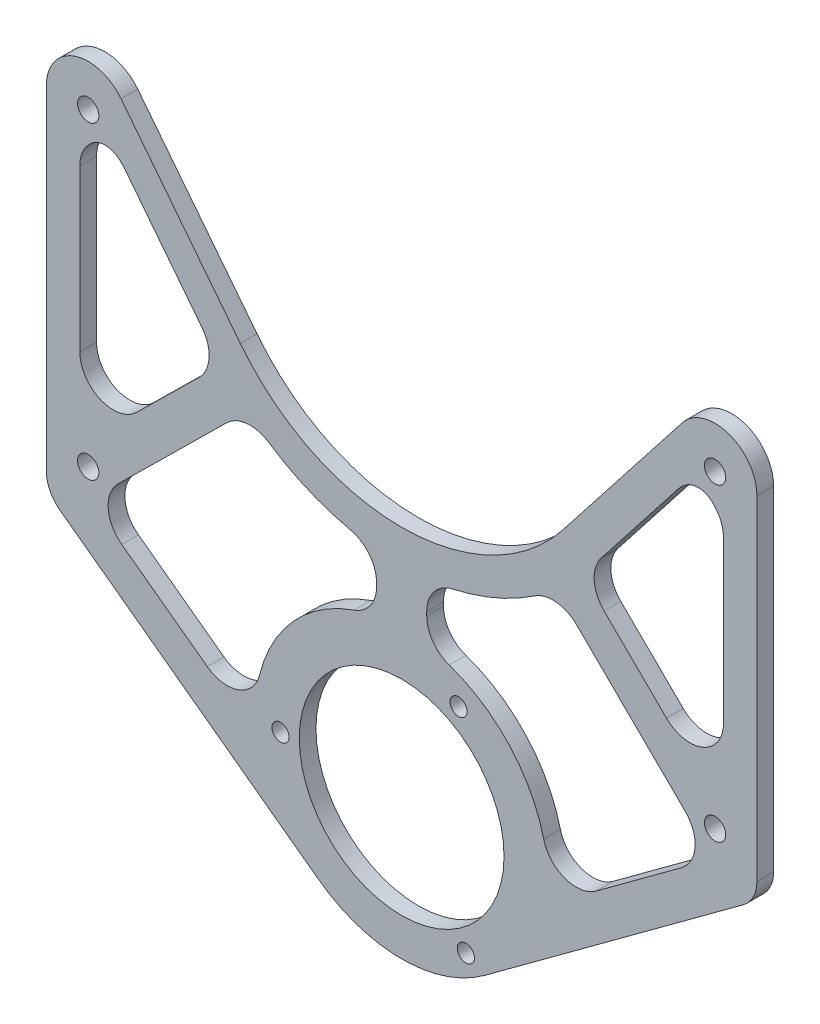
from build123d import *

# Parameters (mm, degrees)
SKETCH_1_R          = 2.55
EXTRUDE_1_DEPTH     = 4
EXTRUDE_2_DEPTH     = 4
FILLET_2_R          = 10
SKETCH_5_R          = 2.05
SKETCH_5_R_2        = 24.5
CUT_EXTRUDE_1_DEPTH = 5
CUT_EXTRUDE_2_DEPTH = 5
CUT_EXTRUDE_3_DEPTH = 25
FILLET_3_R          = 8
FILLET_4_R          = 5


with BuildPart() as part:
    # 草图1 → 凸台-拉伸1 (new body)
    with BuildSketch(Plane.XY):
        with BuildLine():
            Line((-85, -84), (85, -84))
            Line((85, -84), (85, 10))
            Line((85, 10), (48.019813619, 10))
            ThreePointArc((48.019813619, 10), (0, -49.05), (-48.019813619, 10))
            Line((-48.019813619, 10), (-85, 10))
            Line((-85, 10), (-85, -84))
        make_face()
        with Locations((75, 0)):
            Circle(SKETCH_1_R, mode=Mode.SUBTRACT)
        with Locations((-75, 0)):
            Circle(SKETCH_1_R, mode=Mode.SUBTRACT)
        with Locations((-75, -74)):
            Circle(SKETCH_1_R, mode=Mode.SUBTRACT)
        with Locations((75, -74)):
            Circle(SKETCH_1_R, mode=Mode.SUBTRACT)
    extrude(amount=EXTRUDE_1_DEPTH)

    # 草图2 → 凸台-拉伸2 (add)
    with BuildSketch(Plane.XY.offset(4)):
        with BuildLine():
            Line((-85, -84), (-19.866917685, -131.97323825))
            ThreePointArc((-19.866917685, -131.97323825), (0, -138.5), (19.866917685, -131.97323825))
            Line((19.866917685, -131.97323825), (85, -84))
            Line((85, -84), (-85, -84))
        make_face()
    extrude(amount=-EXTRUDE_2_DEPTH)

    # 圆角2
    fillet_2_edges = [part.edges().sort_by_distance(p)[0] for p in [
        (85, 10, 2),
        (-85, 10, 2),
    ]]
    fillet(fillet_2_edges, radius=FILLET_2_R)

    # 草图5 → 切除-拉伸1 (cut)
    with BuildSketch(Plane.XY.offset(4)):
        with Locations((15.367658663, -129.593394789)):
            Circle(SKETCH_5_R)
        with Locations((-28.982333984, -106.012085404)):
            Circle(SKETCH_5_R)
        with Locations((13.614675321, -79.394519807)):
            Circle(SKETCH_5_R)
        with Locations((0, -105)):
            Circle(SKETCH_5_R_2)
    extrude(amount=-CUT_EXTRUDE_1_DEPTH, mode=Mode.SUBTRACT)

    # 草图6 → 切除-拉伸2 (cut)
    with BuildSketch(Plane.XY.offset(4)):
        with BuildLine():
            Line((-67.126666667, 6.165275519), (-38.6187, -30.24067642))
            Line((-38.6187, -30.24067642), (38.6187, -30.24067642))
            Line((38.6187, -30.24067642), (67.126666667, 6.165275519))
            ThreePointArc((67.126666667, 6.165275519), (70.621230492, 8.990349136), (75, 10))
            Line((75, 10), (-75, 10))
            ThreePointArc((-75, 10), (-70.621230492, 8.990349136), (-67.126666667, 6.165275519))
        make_face()
    extrude(amount=-CUT_EXTRUDE_2_DEPTH, mode=Mode.SUBTRACT)

    # 草图7 → 切除-拉伸3 (cut)
    with BuildSketch(Plane.XY.offset(4)):
        Polygon((-77, -5.144778907), (-68.857155974, -4.600712255), (-43.359613768, -37.162217147), (-77, -70.354064895), align=None)
        with BuildLine():
            ThreePointArc((-36.942273764, -43.473795661), (-22.471434931, -52.437935811), (-6, -56.733609968))
            Line((-6, -56.733609968), (-6, -70.518120701))
            ThreePointArc((-6, -70.518120701), (-28.302069217, -84.408912655), (-34.654792832, -109.903604165))
            Line((-34.654792832, -109.903604165), (-74.514618659, -80.545175958))
            Line((-74.514618659, -80.545175958), (-36.942273764, -43.473795661))
        make_face()
        with BuildLine():
            ThreePointArc((34.654792832, -109.903604165), (28.302069217, -84.408912655), (6, -70.518120701))
            Line((6, -70.518120701), (6, -56.733609968))
            ThreePointArc((6, -56.733609968), (22.471434931, -52.437935811), (36.942273764, -43.473795661))
            Line((36.942273764, -43.473795661), (74.514618659, -80.545175958))
            Line((74.514618659, -80.545175958), (34.654792832, -109.903604165))
        make_face()
        Polygon((77, -70.354064895), (43.359613768, -37.162217147), (68.857155974, -4.600712255), (77, -5.144778907), align=None)
    extrude(amount=-CUT_EXTRUDE_3_DEPTH, mode=Mode.SUBTRACT)

    # 圆角3
    # the kernel refuses this fillet: 8 mm, written as the material it adds along each edge
    with BuildSketch(Plane(origin=(-6, -56.733609968, 4), x_dir=(0, -1, 0), z_dir=(0, 0, -1))) as fillet_3_piece_1:
        with BuildLine():
            CenterArc((6.791995106, 8), FILLET_3_R, 192.428379519, 77.571620481)
            ThreePointArc((-1.020531268, 6.278247502), (-0.422700314, 3.153357523), (0, 0))
            Line((0, 0), (6.791995106, 0))
        make_face()
    extrude(amount=4)
    with BuildSketch(Plane(origin=(-6, -70.518120701, 4), x_dir=(-0.9684273836136271, -0.2492958135774943, 0), z_dir=(0, 0, -1))) as fillet_3_piece_2:
        with BuildLine():
            CenterArc((6.207961727, 7.97462195), FILLET_3_R, 194.435845985, 70.999197637)
            Line((-1.539457342, 5.980255442), (0, 0))
            ThreePointArc((0, 0), (2.785623852, 0.111028967), (5.571247704, 0))
        make_face()
    extrude(amount=4)
    with BuildSketch(Plane(origin=(-34.654792832, -109.903604165, 4), x_dir=(-0.8051712910421941, 0.5930423189633656, 0), z_dir=(0, 0, -1))) as fillet_3_piece_3:
        with BuildLine():
            CenterArc((14.713311973, 8), FILLET_3_R, 157.435643024, 112.564356976)
            ThreePointArc((7.325719141, 11.069767442), (4.192460552, 5.184405893), (0, 0))
            Line((0, 0), (14.713311973, 0))
        make_face()
    extrude(amount=4)
    with BuildSketch(Plane(origin=(-74.514618659, -80.545175958, 4), x_dir=(0.711836432832338, 0.7023452803945736, 0), z_dir=(0, 0, -1)), Plane(origin=(74.514618659, -80.545175958, 4), x_dir=(-0.8051712910421942, -0.5930423189633655, 0), z_dir=(0, 0, -1))) as fillet_3_piece_4:
        with BuildLine():
            CenterArc((FILLET_3_R * 1.17108402506, FILLET_3_R), FILLET_3_R, 170.988669267, 99.011330733)
            Line((FILLET_3_R * 0.183426640042, FILLET_3_R * 1.15662978584), (0, 0))
            Line((0, 0), (FILLET_3_R * 1.17108402506, 0))
        make_face()
    extrude(amount=4)
    with BuildSketch(Plane(origin=(-36.942273764, -43.473795661, 4), x_dir=(-0.711836432832338, -0.7023452803945739, 0), z_dir=(0, 0, -1))) as fillet_3_piece_5:
        with BuildLine():
            CenterArc((6.907291952, -8), FILLET_3_R, 90, 78.47203041)
            ThreePointArc((-0.931326161, -6.401229823), (-0.374864481, -3.213825359), (0, 0))
            Line((0, 0), (6.907291952, 0))
        make_face()
    extrude(amount=4)
    with BuildSketch(Plane(origin=(43.359613768, -37.162217147, 4), x_dir=(0.616527551876007, 0.7873333333333332, 0), z_dir=(0, 0, -1)), Plane(origin=(-43.359613768, -37.162217147, 4), x_dir=(-0.7118364328323388, -0.7023452803945729, 0), z_dir=(0, 0, -1))) as fillet_3_piece_6:
        with BuildLine():
            CenterArc((FILLET_3_R * 0.891711791031, FILLET_3_R), FILLET_3_R, 186.552471372, 83.447528628)
            Line((-FILLET_3_R * 0.101755976712, FILLET_3_R * 0.885886922506), (0, 0))
            Line((0, 0), (FILLET_3_R * 0.891711791031, 0))
        make_face()
    extrude(amount=4)
    with BuildSketch(Plane(origin=(68.857155974, -4.600712255, 4), x_dir=(0.9977753031397176, -0.06666666666666672, 0), z_dir=(0, 0, -1)), Plane(origin=(-68.857155974, -4.600712255, 4), x_dir=(0.6165275518760065, -0.7873333333333337, 0), z_dir=(0, 0, -1))) as fillet_3_piece_7:
        with BuildLine():
            CenterArc((FILLET_3_R * 0.529020931448, FILLET_3_R), FILLET_3_R, 214.240445239, 55.759554761)
            Line((-FILLET_3_R * 0.297662660682, FILLET_3_R * 0.437332923922), (0, 0))
            Line((0, 0), (FILLET_3_R * 0.529020931448, 0))
        make_face()
    extrude(amount=4)
    with BuildSketch(Plane(origin=(77, -5.144778907, 4), x_dir=(0, -1, 0), z_dir=(0, 0, -1))) as fillet_3_piece_8:
        with BuildLine():
            CenterArc((FILLET_3_R * 0.935414346693, FILLET_3_R), FILLET_3_R, 183.822553729, 86.177446271)
            Line((-FILLET_3_R * 0.0623609564462, FILLET_3_R * 0.933333333333), (0, 0))
            Line((0, 0), (FILLET_3_R * 0.935414346693, 0))
        make_face()
    extrude(amount=4)
    with BuildSketch(Plane(origin=(77, -70.354064895, 4), x_dir=(0, 1, 0), z_dir=(0, 0, -1))) as fillet_3_piece_9:
        with BuildLine():
            CenterArc((FILLET_3_R * 2.39148377615, -FILLET_3_R), FILLET_3_R, 90, 134.61547034)
            Line((FILLET_3_R * 1.67964734332, -FILLET_3_R * 1.70234528039), (0, 0))
            Line((0, 0), (FILLET_3_R * 2.39148377615, 0))
        make_face()
    extrude(amount=4)
    with BuildSketch(Plane(origin=(-77, -70.354064895, 4), x_dir=(0, 1, 0), z_dir=(0, 0, -1))) as fillet_3_piece_10:
        with BuildLine():
            CenterArc((FILLET_3_R * 2.39148377615, FILLET_3_R), FILLET_3_R, 135.38452966, 134.61547034)
            Line((FILLET_3_R * 1.67964734332, FILLET_3_R * 1.70234528039), (0, 0))
            Line((0, 0), (FILLET_3_R * 2.39148377615, 0))
        make_face()
    extrude(amount=4)
    with BuildSketch(Plane(origin=(-77, -5.144778907, 4), x_dir=(0, -1, 0), z_dir=(0, 0, -1))) as fillet_3_piece_11:
        with BuildLine():
            CenterArc((FILLET_3_R * 0.935414346693, -FILLET_3_R), FILLET_3_R, 90, 86.177446271)
            Line((-FILLET_3_R * 0.0623609564462, -FILLET_3_R * 0.933333333333), (0, 0))
            Line((0, 0), (FILLET_3_R * 0.935414346693, 0))
        make_face()
    extrude(amount=4)
    with BuildSketch(Plane(origin=(6, -56.733609968, 4), x_dir=(0.9870448668515611, 0.16044447893892722, 0), z_dir=(0, 0, -1))) as fillet_3_piece_12:
        with BuildLine():
            CenterArc((6.806620819, 7.987559736), FILLET_3_R, 189.232696301, 77.571620481)
            Line((-1.089738116, 6.704003905), (0, 0))
            ThreePointArc((0, 0), (3.180325289, 0.08871463), (6.360650577, 0))
        make_face()
    extrude(amount=4)
    with BuildSketch(Plane(origin=(36.942273764, -43.473795661, 4), x_dir=(0.7118364328323379, -0.7023452803945738, 0), z_dir=(0, 0, -1))) as fillet_3_piece_13:
        with BuildLine():
            CenterArc((6.907291952, 8), FILLET_3_R, 191.52796959, 78.47203041)
            ThreePointArc((-0.931326161, 6.401229823), (-0.374864481, 3.213825359), (0, 0))
            Line((0, 0), (6.907291952, 0))
        make_face()
    extrude(amount=4)
    with BuildSketch(Plane(origin=(6, -70.518120701, 4), x_dir=(0, 1, 0), z_dir=(0, 0, -1))) as fillet_3_piece_14:
        with BuildLine():
            CenterArc((6.175223401, 8), FILLET_3_R, 199.000802363, 70.999197637)
            ThreePointArc((-1.388888729, 5.395348837), (-0.586920873, 2.725353475), (0, 0))
            Line((0, 0), (6.175223401, 0))
        make_face()
    extrude(amount=4)
    with BuildSketch(Plane(origin=(34.654792832, -109.903604165, 4), x_dir=(0.8051712910421941, 0.5930423189633658, 0), z_dir=(0, 0, -1))) as fillet_3_piece_15:
        with BuildLine():
            CenterArc((14.713311973, -8), FILLET_3_R, 90, 112.564356976)
            ThreePointArc((7.325719141, -11.069767442), (4.192460552, -5.184405893), (0, 0))
            Line((0, 0), (14.713311973, 0))
        make_face()
    extrude(amount=4)
    # the kernel refuses this fillet: 8 mm, written as the material it takes off along each edge
    with BuildSketch(Plane(origin=(-85, -84, -10.108598892), x_dir=(0, 1, 0), z_dir=(0, 0, 1))) as fillet_3_2_piece_1:
        with BuildLine():
            CenterArc((FILLET_3_R * 0.505429944614, -FILLET_3_R), FILLET_3_R, 90, 53.626801073)
            Line((-FILLET_3_R * 0.299741346428, -FILLET_3_R * 0.406957681037), (0, 0))
            Line((0, 0), (FILLET_3_R * 0.505429944614, 0))
        make_face()
    extrude(amount=24.217197785, mode=Mode.SUBTRACT)
    with BuildSketch(Plane(origin=(85, -84, -10.108598892), x_dir=(0, 1, 0), z_dir=(0, 0, 1))) as fillet_3_2_piece_2:
        with BuildLine():
            CenterArc((FILLET_3_R * 0.505429944614, FILLET_3_R), FILLET_3_R, 216.373198927, 53.626801073)
            Line((-FILLET_3_R * 0.299741346428, FILLET_3_R * 0.406957681037), (0, 0))
            Line((0, 0), (FILLET_3_R * 0.505429944614, 0))
        make_face()
    extrude(amount=24.217197785, mode=Mode.SUBTRACT)

    # 圆角4
    fillet_4_edges = [part.edges().sort_by_distance(p)[0] for p in [
        (71.293293442, -4.963838649, 2),
        (-71.293293442, -4.963838649, 2),
    ]]
    fillet(fillet_4_edges, radius=FILLET_4_R)


solid = part.part
